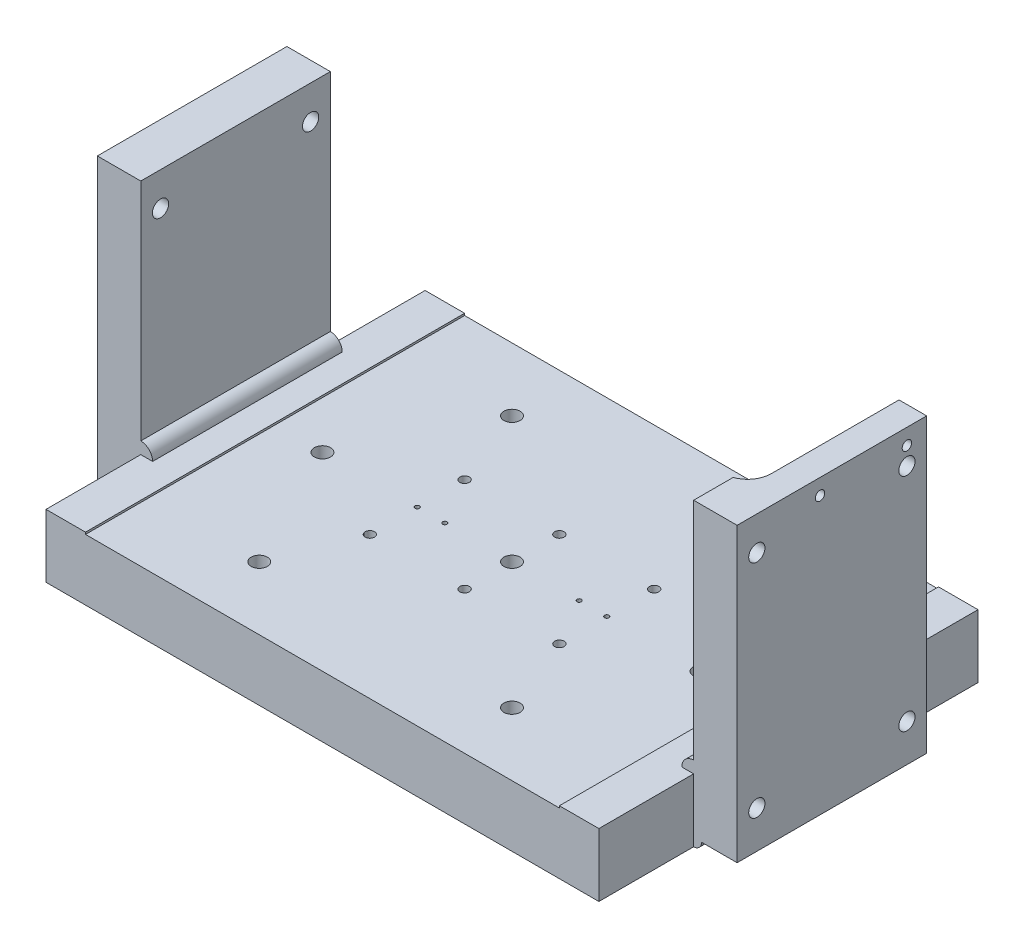
from build123d import *

# Parameters (mm, degrees)
SKETCH1_W                                        = 222.25
SKETCH1_H                                        = 152.4
EXTRUDE1_DEPTH                                   = 25.4
SKETCH2_W                                        = 17.4625
SKETCH2_H                                        = 76.2
EXTRUDE2_DEPTH                                   = 117.475
SKETCH5_W                                        = 190.5
SKETCH5_H                                        = 152.4
CUT_EXTRUDE1_DEPTH                               = 0.79375
F_5_16_18_TAPPED_HOLE1_D                         = 6.5278
F_5_16_18_TAPPED_HOLE1_DEPTH                     = 22.9235
F_5_16_18_TAPPED_HOLE1_TIP                       = 1.961148974
F_5_16_18_TAPPED_HOLE2_D                         = 6.5278
F_5_16_18_TAPPED_HOLE2_DEPTH                     = 22.9235
F_5_16_18_TAPPED_HOLE2_TIP                       = 1.961148974
SKETCH9_R                                        = 4.7625
SKETCH9_R_2                                      = 3.175
EXTRUDE3_DEPTH                                   = 38.1
F_5_16_18_TAPPED_HOLE3_D                         = 6.5278
F_10_24_TAPPED_HOLE2_D                           = 3.7973
F_1_4_20_TAPPED_HOLE1_D                          = 5.1054
F_1_4_20_TAPPED_HOLE1_DEPTH                      = 16.51
F_1_4_20_TAPPED_HOLE1_TIP                        = 1.533816902
F_2_56_TAPPED_HOLE1_D                            = 1.778
F_2_56_TAPPED_HOLE1_DEPTH                        = 6.604
F_2_56_TAPPED_HOLE1_TIP                          = 0.53416509
F_10_24_TAPPED_HOLE3_D                           = 3.7973
F_10_24_TAPPED_HOLE3_DEPTH                       = 17.4625
SKETCH21_W                                       = 60.325
SKETCH21_H                                       = 12.7
CUT_EXTRUDE2_DEPTH                               = 6.35
FILLET1_R                                        = 9.525
CBORE_FOR_1_4_SOCKET_HEAD_CAP_SCREW1_D           = 6.5278
CBORE_FOR_1_4_SOCKET_HEAD_CAP_SCREW1_DEPTH       = 120.65
CBORE_FOR_1_4_SOCKET_HEAD_CAP_SCREW1_CBORE_D     = 11.1125
CBORE_FOR_1_4_SOCKET_HEAD_CAP_SCREW1_CBORE_DEPTH = 7.112


with BuildPart() as part:
    # Sketch1 → Extrude1 (new body)
    with BuildSketch(Plane(origin=(0, 0, 0), x_dir=(1, 0, 0), z_dir=(0, 1, 0))):
        Rectangle(SKETCH1_W, SKETCH1_H)
    extrude(amount=EXTRUDE1_DEPTH)

    # Sketch2 → Extrude2 (add)
    with BuildSketch(Plane(origin=(0, 3.175, 0), x_dir=(-1, 0, 0), z_dir=(0, 1, 0))):
        with Locations((119.85625, 0)):
            Rectangle(SKETCH2_W, SKETCH2_H)
        with Locations((-119.85625, 0)):
            Rectangle(SKETCH2_W, SKETCH2_H)
    extrude(amount=EXTRUDE2_DEPTH)

    # Sketch5 → Cut-Extrude1 (cut)
    with BuildSketch(Plane(origin=(0, 25.4, 0), x_dir=(-1, 0, 0), z_dir=(0, 1, 0))):
        Rectangle(SKETCH5_W, SKETCH5_H)
    extrude(amount=-CUT_EXTRUDE1_DEPTH, mode=Mode.SUBTRACT)

    # 5/16-18 Tapped Hole1
    with Locations(Plane(origin=(128.5875, 0, 0), x_dir=(0, 0, -1), z_dir=(1, 0, 0))):
        with Locations((-30.1625, 107.15625), (-30.1625, 18.25625), (30.1625, 18.25625), (30.1625, 107.15625)):
            Hole(F_5_16_18_TAPPED_HOLE1_D / 2, depth=F_5_16_18_TAPPED_HOLE1_DEPTH)
            with Locations((0, 0, -(F_5_16_18_TAPPED_HOLE1_DEPTH + F_5_16_18_TAPPED_HOLE1_TIP / 2))):  # 118° drill point
                Cone(0, F_5_16_18_TAPPED_HOLE1_D / 2, F_5_16_18_TAPPED_HOLE1_TIP, mode=Mode.SUBTRACT)

    # 5/16-18 Tapped Hole2
    with Locations(Plane.ZY.offset(128.5875)):
        with Locations((30.1625, 107.15625), (-30.1625, 107.15625), (-30.1625, 18.25625), (30.1625, 18.25625)):
            Hole(F_5_16_18_TAPPED_HOLE2_D / 2, depth=F_5_16_18_TAPPED_HOLE2_DEPTH)
            with Locations((0, 0, -(F_5_16_18_TAPPED_HOLE2_DEPTH + F_5_16_18_TAPPED_HOLE2_TIP / 2))):  # 118° drill point
                Cone(0, F_5_16_18_TAPPED_HOLE2_D / 2, F_5_16_18_TAPPED_HOLE2_TIP, mode=Mode.SUBTRACT)

    # Sketch9 → Extrude3 (add, symmetric)
    with BuildSketch(Plane.XY):
        with Locations((-111.125, 25.4)):
            Circle(SKETCH9_R)
        with Locations((-111.125, 3.175)):
            Circle(SKETCH9_R_2)
        with Locations((111.125, 3.175)):
            Circle(SKETCH9_R_2)
        with Locations((111.125, 25.4)):
            Circle(SKETCH9_R)
    extrude(amount=EXTRUDE3_DEPTH, both=True)

    # 5/16-18 Tapped Hole3 (through all)
    with Locations(Plane(origin=(0, 24.60625, 0), x_dir=(-1, 0, 0), z_dir=(0, 1, 0))):
        with Locations((0, 0), (50.8, -50.8), (50.8, 50.8), (-50.8, 50.8), (-50.8, -50.8), (76.2, 0), (-76.2, 0)):
            Hole(F_5_16_18_TAPPED_HOLE3_D / 2)

    # #10-24 Tapped Hole2 (through all)
    with Locations(Plane(origin=(0, 24.60625, 0), x_dir=(-1, 0, 0), z_dir=(0, 1, 0))):
        with Locations((38.1, 19.05), (38.1, -19.05), (0, -19.05), (0, 19.05), (-38.1, 19.05), (-38.1, -19.05)):
            Hole(F_10_24_TAPPED_HOLE2_D / 2)

    # 1/4-20 Tapped Hole1
    with Locations(Plane.ZY.offset(111.125)):
        with Locations((-68.2625, 12.7), (-68.2625, 20.6375)):
            Hole(F_1_4_20_TAPPED_HOLE1_D / 2, depth=F_1_4_20_TAPPED_HOLE1_DEPTH)
            with Locations((0, 0, -(F_1_4_20_TAPPED_HOLE1_DEPTH + F_1_4_20_TAPPED_HOLE1_TIP / 2))):  # 118° drill point
                Cone(0, F_1_4_20_TAPPED_HOLE1_D / 2, F_1_4_20_TAPPED_HOLE1_TIP, mode=Mode.SUBTRACT)

    # #2-56 Tapped Hole1
    with Locations(Plane(origin=(0, 24.60625, 0), x_dir=(-1, 0, 0), z_dir=(0, 1, 0))):
        with Locations((38.1, 0), (26.9875, 0), (-38.1, 0), (-26.9875, 0)):
            Hole(F_2_56_TAPPED_HOLE1_D / 2, depth=F_2_56_TAPPED_HOLE1_DEPTH)
            with Locations((0, 0, -(F_2_56_TAPPED_HOLE1_DEPTH + F_2_56_TAPPED_HOLE1_TIP / 2))):  # 118° drill point
                Cone(0, F_2_56_TAPPED_HOLE1_D / 2, F_2_56_TAPPED_HOLE1_TIP, mode=Mode.SUBTRACT)

    # #10-24 Tapped Hole3
    with Locations(Plane(origin=(128.5875, 0, 0), x_dir=(0, 0, -1), z_dir=(1, 0, 0))):
        with Locations((-4.7625, 114.3), (30.1625, 114.3)):
            Hole(F_10_24_TAPPED_HOLE3_D / 2, depth=F_10_24_TAPPED_HOLE3_DEPTH)

    # Sketch21 → Cut-Extrude2 (cut)
    with BuildSketch(Plane.ZY.offset(-111.125)):
        with Locations((-7.9375, 114.3)):
            Rectangle(SKETCH21_W, SKETCH21_H)
    extrude(amount=-CUT_EXTRUDE2_DEPTH, mode=Mode.SUBTRACT)

    # Fillet1
    # the kernel refuses this fillet: 9.525 mm, written as the material it adds along each edge
    with BuildSketch(Plane(origin=(117.475, 120.65, 22.225), x_dir=(0, 0, -1), z_dir=(0, -1, 0))) as fillet1_piece_1:
        with BuildLine():
            CenterArc((8.980256121, -9.525), FILLET1_R, 90, 70.528779366)
            Line((0, -6.35), (-0.179605122, -6.2865))
            ThreePointArc((-0.179605122, -6.2865), (-0.1905, -3.175), (-0.1905, 0))
            Line((-0.1905, 0), (0, 0.1905))
            Line((0, 0.1905), (8.980256121, 0.1905))
            Line((8.980256121, 0.1905), (8.980256121, 0))
        make_face()
    extrude(amount=35.150640303)

    # CBORE for 1/4 Socket Head Cap Screw1
    with Locations(Plane.XZ):
        with Locations((-50.8, 50.8), (50.8, 50.8), (50.8, -50.8), (0, 0), (-50.8, -50.8), (-76.2, 0), (76.2, 0)):
            CounterBoreHole(CBORE_FOR_1_4_SOCKET_HEAD_CAP_SCREW1_D / 2, CBORE_FOR_1_4_SOCKET_HEAD_CAP_SCREW1_CBORE_D / 2, CBORE_FOR_1_4_SOCKET_HEAD_CAP_SCREW1_CBORE_DEPTH, depth=CBORE_FOR_1_4_SOCKET_HEAD_CAP_SCREW1_DEPTH)


solid = part.part
